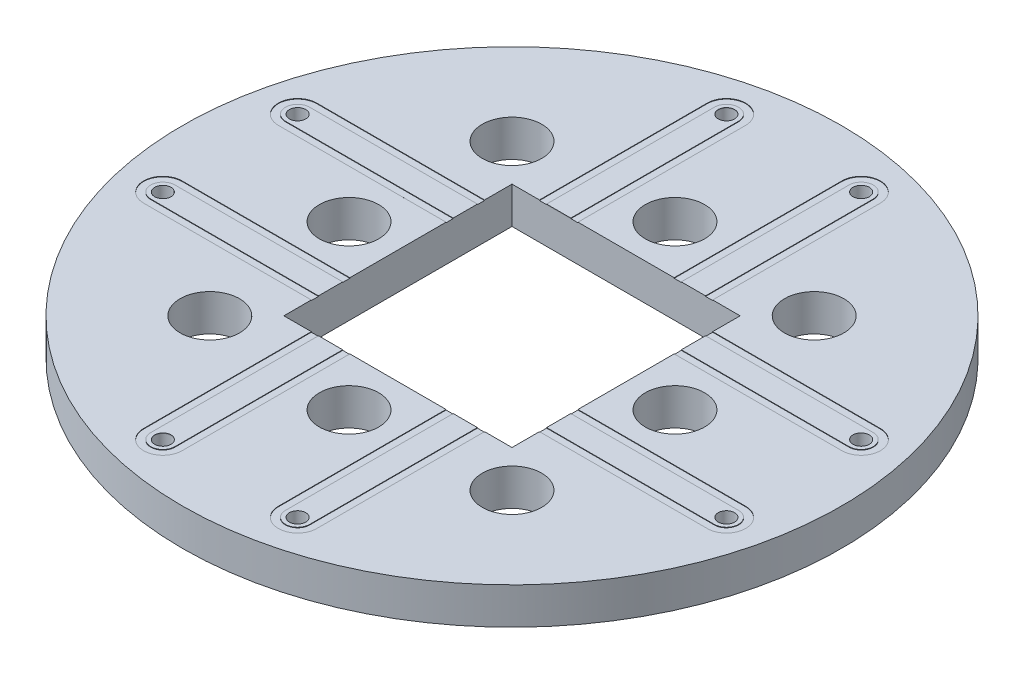
from build123d import *

# Parameters (mm, degrees)
BODAY_SKETCH_R    = 11.557
BODY_DEPTH        = 1.27
COPPER_START      = 0.017500092
COPPER_SKETCH_R   = 11.557
COPPER_DEPTH      = 0.017500092
GAP_CUT_DEPTH     = 17.39333395
CENTER_DEPTH      = 0.017500092
IO_HOLE_SKETCH_R  = 0.287000061
IO_HOLE_DEPTH     = 17.39333395
GAP_CUTS_COUNT    = 4
CENTERS_COUNT     = 4
IO_HOLES_COUNT    = 4
POCKET_DEPTH      = 17.39333395
POCKET_DEPTH_BACK = 17.39333395
POCKET_SKETCH_W   = 8.000000002
POCKET_SKETCH_H   = 8.000000002
POSTS_R           = 1.0414
POST_CUT_DEPTH    = 17.39333395
POST_CUTS_COUNT   = 4


with BuildPart() as part:
    # Boday Sketch → Body (new body)
    with BuildSketch(Plane(origin=(0, 0, 0), x_dir=(1, 0, 0), z_dir=(0, 1, 0))):
        Circle(BODAY_SKETCH_R)
    extrude(amount=-BODY_DEPTH)

    # Copper Sketch → Copper (add)
    with BuildSketch(Plane(origin=(0, 0, 0), x_dir=(1, 0, 0), z_dir=(0, 1, 0)).offset(COPPER_START)):
        Circle(COPPER_SKETCH_R)
    extrude(amount=-COPPER_DEPTH)

    # Gap → Gap Cut (cut, through all)
    with BuildSketch(Plane(origin=(0, 0, 0), x_dir=(1, 0, 0), z_dir=(0, 1, 0))):
        with BuildLine():
            Line((-3.037200047, 9.881579386), (-3.037200047, -9.881579386))
            ThreePointArc((-3.037200047, -9.881579386), (-2.3622, -10.556579433), (-1.687199953, -9.881579386))
            Line((-1.687199953, -9.881579386), (-1.687199953, 9.881579386))
            ThreePointArc((-1.687199953, 9.881579386), (-2.3622, 10.556579433), (-3.037200047, 9.881579386))
        make_face()
    gap_cut = extrude(amount=GAP_CUT_DEPTH, mode=Mode.SUBTRACT)


with BuildPart() as body_2:
    # Center Sketch → Center (new body)
    with BuildSketch(Plane(origin=(0, 0, 0), x_dir=(1, 0, 0), z_dir=(0, 1, 0))):
        with BuildLine():
            Line((-2.787200039, 9.881579386), (-2.787200039, -9.881579386))
            ThreePointArc((-2.787200039, -9.881579386), (-2.3622, -10.306579425), (-1.937199961, -9.881579386))
            Line((-1.937199961, -9.881579386), (-1.937199961, 9.881579386))
            ThreePointArc((-1.937199961, 9.881579386), (-2.3622, 10.306579425), (-2.787200039, 9.881579386))
        make_face()
    center = extrude(amount=CENTER_DEPTH)


with BuildPart() as io_hole_tool:
    # IO Hole Sketch → IO Hole (new, symmetric)
    with BuildSketch(Plane(origin=(0, 0, 0), x_dir=(1, 0, 0), z_dir=(0, 1, 0))):
        with Locations((-2.3622, 9.881579386)):
            Circle(IO_HOLE_SKETCH_R)
        with Locations((-2.3622, -9.881579386)):
            Circle(IO_HOLE_SKETCH_R)
    io_hole = extrude(amount=IO_HOLE_DEPTH, both=True)


with BuildPart() as part_1:
    add(part.part)

    # IO Hole: cut by io_hole_tool
    add(io_hole_tool.part, mode=Mode.SUBTRACT)

    # Gap Cuts: Gap Cut ×4 about axis
    gap_cuts_axis = Axis((0, 0.0762, 0), (0, -1, 0))
    for i in range(1, GAP_CUTS_COUNT):
        add(gap_cut.rotate(gap_cuts_axis, i * 360 / GAP_CUTS_COUNT), mode=Mode.SUBTRACT)

    # Centers: Center ×4 about axis
    centers_axis = Axis((0, 0.0762, 0), (0, -1, 0))
    for i in range(1, CENTERS_COUNT):
        add(center.rotate(centers_axis, i * 360 / CENTERS_COUNT))

    # IO Holes: IO Hole ×4 about axis
    io_holes_axis = Axis((0, 0.0762, 0), (0, -1, 0))
    for i in range(1, IO_HOLES_COUNT):
        add(io_hole.rotate(io_holes_axis, i * 360 / IO_HOLES_COUNT), mode=Mode.SUBTRACT)


with BuildPart() as body_2_1:
    add(body_2.part)

    # IO Hole: cut by io_hole_tool
    add(io_hole_tool.part, mode=Mode.SUBTRACT)


with BuildPart() as pocket_tool:
    # Pocket Sketch → Pocket (new, two sides: drawn at the far end of the back side and taken through both)
    with BuildSketch(Plane(origin=(0, 0, 0), x_dir=(1, 0, 0), z_dir=(0, 1, 0)).offset(-POCKET_DEPTH_BACK)):
        Rectangle(POCKET_SKETCH_W, POCKET_SKETCH_H)
    extrude(amount=POCKET_DEPTH + POCKET_DEPTH_BACK)


with BuildPart() as part_2:
    add(part_1.part)

    # Pocket: cut by pocket_tool
    add(pocket_tool.part, mode=Mode.SUBTRACT)

    # Posts → Post Cut (cut, symmetric)
    with BuildSketch(Plane(origin=(0, 0, 0), x_dir=(1, 0, 0), z_dir=(0, 1, 0))):
        with Locations((0, 5.715)):
            Circle(POSTS_R)
        with Locations((-5.298351111, 5.298351111)):
            Circle(POSTS_R)
    post_cut = extrude(amount=POST_CUT_DEPTH, both=True, mode=Mode.SUBTRACT)

    # Post Cuts: Post Cut ×4 about axis
    post_cuts_axis = Axis((0, 0.0762, 0), (0, -1, 0))
    for i in range(1, POST_CUTS_COUNT):
        add(post_cut.rotate(post_cuts_axis, i * 360 / POST_CUTS_COUNT), mode=Mode.SUBTRACT)


with BuildPart() as body_2_2:
    add(body_2_1.part)

    # Pocket: cut by pocket_tool
    add(pocket_tool.part, mode=Mode.SUBTRACT)


solid = Compound([part_2.part, body_2_2.part])
